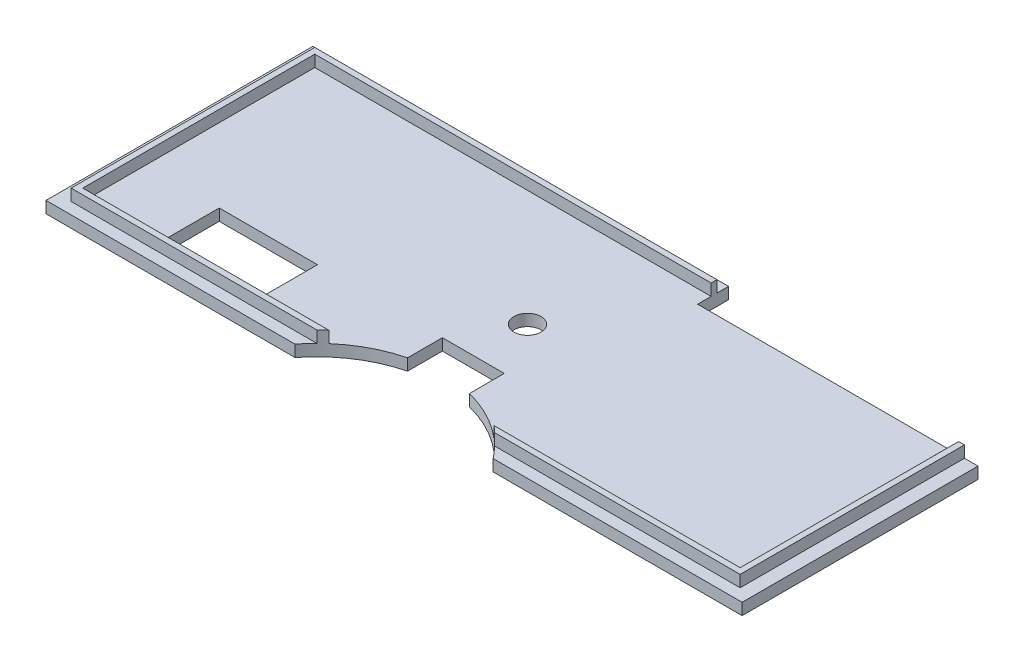
from build123d import *

# Parameters (mm, degrees)
SKETCH2_W           = 180
SKETCH2_H           = 69
BOSS_EXTRUDE1_DEPTH = 3
SKETCH3_W           = 173
SKETCH3_H           = 63
SKETCH3_W_2         = 170
SKETCH3_H_2         = 60
BOSS_EXTRUDE2_DEPTH = 3
SKETCH4_W           = 25.4
SKETCH4_H           = 16
CUT_EXTRUDE1_DEPTH  = 10
SKETCH5_W           = 69
SKETCH5_H           = 1.5
CUT_EXTRUDE2_DEPTH  = 3
SKETCH6_W           = 1.5
SKETCH6_H           = 3.5
CUT_EXTRUDE3_DEPTH  = 3
SKETCH7_R           = 3.5
CUT_EXTRUDE4_DEPTH  = 3
SKETCH8_R           = 32.5
CUT_EXTRUDE5_DEPTH  = 10
SKETCH9_W           = 16
SKETCH9_H           = 16
CUT_EXTRUDE6_DEPTH  = 10
SKETCH10_W          = 72.5
SKETCH10_H          = 8
CUT_EXTRUDE7_DEPTH  = 10


with BuildPart() as part:
    # Sketch2 → Boss-Extrude1 (new body)
    with BuildSketch(Plane(origin=(0, 0, 0), x_dir=(1, 0, 0), z_dir=(0, 1, 0))):
        Rectangle(SKETCH2_W, SKETCH2_H)
    extrude(amount=BOSS_EXTRUDE1_DEPTH)

    # Sketch3 → Boss-Extrude2 (add)
    with BuildSketch(Plane(origin=(0, 3, 0), x_dir=(1, 0, 0), z_dir=(0, 1, 0))):
        Rectangle(SKETCH3_W, SKETCH3_H)
        Rectangle(SKETCH3_W_2, SKETCH3_H_2, mode=Mode.SUBTRACT)
    extrude(amount=BOSS_EXTRUDE2_DEPTH)

    # Sketch4 → Cut-Extrude1 (cut)
    with BuildSketch(Plane.XZ):
        with Locations((-53.2, 21.8)):
            Rectangle(SKETCH4_W, SKETCH4_H)
    extrude(amount=-CUT_EXTRUDE1_DEPTH, mode=Mode.SUBTRACT)

    # Sketch5 → Cut-Extrude2 (cut)
    with BuildSketch(Plane(origin=(0, 6, 0), x_dir=(1, 0, 0), z_dir=(0, 1, 0))):
        with Locations((52, 30.75)):
            Rectangle(SKETCH5_W, SKETCH5_H)
    extrude(amount=-CUT_EXTRUDE2_DEPTH, mode=Mode.SUBTRACT)

    # Sketch6 → Cut-Extrude3 (cut)
    with BuildSketch(Plane(origin=(0, 6, 0), x_dir=(1, 0, 0), z_dir=(0, 1, 0))):
        with Locations((85.75, 28.25)):
            Rectangle(SKETCH6_W, SKETCH6_H)
    extrude(amount=-CUT_EXTRUDE3_DEPTH, mode=Mode.SUBTRACT)

    # Sketch7 → Cut-Extrude4 (cut)
    with BuildSketch(Plane.XZ):
        Circle(SKETCH7_R)
    extrude(amount=-CUT_EXTRUDE4_DEPTH, mode=Mode.SUBTRACT)

    # Sketch8 → Cut-Extrude5 (cut)
    with BuildSketch(Plane.XZ):
        with Locations((0, 54.5)):
            Circle(SKETCH8_R)
    extrude(amount=-CUT_EXTRUDE5_DEPTH, mode=Mode.SUBTRACT)

    # Sketch9 → Cut-Extrude6 (cut)
    with BuildSketch(Plane.XZ):
        with Locations((0, 22)):
            Rectangle(SKETCH9_W, SKETCH9_H)
    extrude(amount=-CUT_EXTRUDE6_DEPTH, mode=Mode.SUBTRACT)

    # Sketch10 → Cut-Extrude7 (cut)
    with BuildSketch(Plane(origin=(0, 3, 0), x_dir=(1, 0, 0), z_dir=(0, 1, 0))):
        with Locations((53.75, 30.5)):
            Rectangle(SKETCH10_W, SKETCH10_H)
    extrude(amount=-CUT_EXTRUDE7_DEPTH, mode=Mode.SUBTRACT)


solid = part.part
